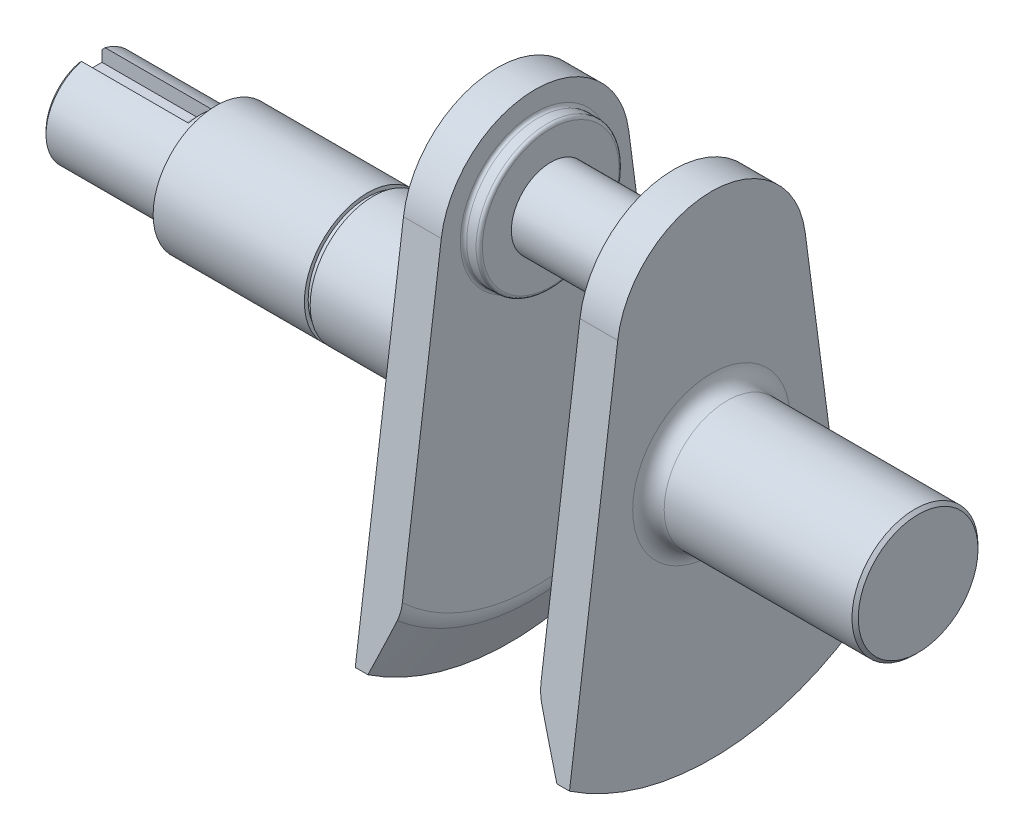
from build123d import *

# Parameters (mm, degrees)
BASE_SKETCH_R          = 12.7
BASE_DEPTH             = 166.878
FRONT_SKETCH_OUTSIDE_W = 61.54
FRONT_SKETCH_OUTSIDE_H = 61.54
FRONT_SKETCH_OUTSIDE_R = 9.525
FRONT_CUT_DEPTH        = 25.4
KEYHOLE_SKETCH_W       = 4.7752
KEYHOLE_SKETCH_H       = 6.35
KEYHOLE_DEPTH          = 22.225
KEYHOLE_FILLET_R       = 3.175
GROOVE_SKETCH_W        = 1.1684
GROOVE_SKETCH_H        = 1.524
EXTERIOR_START         = -82.042
EXTERIOR_SKETCH_R      = 12.7
EXTERIOR_CUT_DEPTH     = 43.18
SHAFT_SKETCH_R         = 19.05
SHAFT_SKETCH_R_2       = 14.4145
SHAFT_DEPTH            = 7.62
LARGE_CIRCLE_SKETCH_R  = 14.4145
LARGE_CIRCLE_DEPTH     = 3.175
BRIDGE_SKETCH_R        = 7.9375
BRIDGE_DEPTH           = 21.59
SHAFT_CHAMFER_SIZE     = 5.08
SHAFT_CHAMFER_SIZE2    = 10.894095156
REAR_CHAMFER_SIZE      = 5.08
REAR_CHAMFER_SIZE2     = 10.894095156
BACK_BASE_SKETCH_R     = 12.7
BACK_BASE_DEPTH        = 41.656
CIRCLE_FILLET_R        = 0.635
BASE_FILLET_R          = 3.175
SHAFT_FILLET_R         = 6.35
BASE_CHAMFER_SIZE      = 0.635


with BuildPart() as part:
    # Base Sketch → Base (new body)
    with BuildSketch(Plane(origin=(0, 0, 0), x_dir=(0, 0, -1), z_dir=(1, 0, 0))):
        Circle(BASE_SKETCH_R)
    extrude(amount=BASE_DEPTH)

    # Front Sketch outside → Front Cut (cut)
    with BuildSketch(Plane.ZY):
        Rectangle(FRONT_SKETCH_OUTSIDE_W, FRONT_SKETCH_OUTSIDE_H)
        Circle(FRONT_SKETCH_OUTSIDE_R, mode=Mode.SUBTRACT)
    extrude(amount=-FRONT_CUT_DEPTH, mode=Mode.SUBTRACT)

    # Keyhole Sketch → Keyhole (cut)
    with BuildSketch(Plane.ZY):
        with Locations((0, 9.525)):
            Rectangle(KEYHOLE_SKETCH_W, KEYHOLE_SKETCH_H)
    extrude(amount=-KEYHOLE_DEPTH, mode=Mode.SUBTRACT)

    # Keyhole Fillet
    keyhole_fillet_edges = [part.edges().sort_by_distance(p)[0] for p in [
        (22.225, 6.35, 0),
    ]]
    fillet(keyhole_fillet_edges, radius=KEYHOLE_FILLET_R - 0.0001)  # a hair under: the kernel refuses the full size

    # Groove Sketch → Front Groove (revolve, cut)
    with BuildSketch(Plane.XY, mode=Mode.PRIVATE) as front_groove_sk:
        with Locations((56.4642, 12.7)):
            Rectangle(GROOVE_SKETCH_W, GROOVE_SKETCH_H)
    revolve(front_groove_sk.sketch.rotate(Axis((0, 0, 0), (1, 0, 0)), 90), axis=Axis((0, 0, 0), (1, 0, 0)), mode=Mode.SUBTRACT)

    # Exterior Sketch → Exterior Cut (cut)
    with BuildSketch(Plane.ZY.offset(EXTERIOR_START)):
        Circle(EXTERIOR_SKETCH_R)
    extrude(amount=-EXTERIOR_CUT_DEPTH, mode=Mode.SUBTRACT)


with BuildPart() as body_2:
    # of the pieces the cut leaves, the one that is kept (exterior_cut_keep)
    add(part.part.solids().sort_by_distance((22.210412317, 9.220899696, 2.3876))[0])

    # Shaft Sketch → Shaft (add)
    # profile 1 of 3: a face of its own
    with BuildSketch(Plane(origin=(82.042, 0, 0), x_dir=(0, 0, -1), z_dir=(1, 0, 0))):
        with BuildLine():
            ThreePointArc((19.05, 28.575), (-1.245929612, 9.565787512), (-18.887024609, 31.061523962))
            Line((-18.887024609, 31.061523962), (-28.605503762, -42.757654032))
            ThreePointArc((-28.605503762, -42.757654032), (0, -51.444065), (28.605503762, -42.757654032))
            Line((28.605503762, -42.757654032), (18.887024609, 31.061523962))
            ThreePointArc((18.887024609, 31.061523962), (19.009212488, 29.820929612), (19.05, 28.575))
        make_face()
    # profile 2 of 3: a face of its own
    with BuildSketch(Plane(origin=(82.042, 0, 0), x_dir=(0, 0, -1), z_dir=(1, 0, 0))):
        with Locations((0, 28.575)):
            Circle(SHAFT_SKETCH_R)
        with Locations((0, 28.575)):
            Circle(SHAFT_SKETCH_R_2, mode=Mode.SUBTRACT)
    # profile 3 of 3: a face of its own
    with BuildSketch(Plane(origin=(82.042, 0, 0), x_dir=(0, 0, -1), z_dir=(1, 0, 0))):
        with Locations((0, 28.575)):
            Circle(SHAFT_SKETCH_R_2)
    shaft = extrude(amount=SHAFT_DEPTH)

    # Large Circle Sketch → Large Circle (add)
    with BuildSketch(Plane(origin=(89.662, 0, 0), x_dir=(0, 0, -1), z_dir=(1, 0, 0))):
        with Locations((0, 28.575)):
            Circle(LARGE_CIRCLE_SKETCH_R)
    large_circle = extrude(amount=LARGE_CIRCLE_DEPTH)

    # Bridge Sketch → Bridge (add)
    with BuildSketch(Plane(origin=(92.837, 0, 0), x_dir=(0, 0, -1), z_dir=(1, 0, 0))):
        with Locations((0, 28.575)):
            Circle(BRIDGE_SKETCH_R)
    extrude(amount=BRIDGE_DEPTH)

    # Shaft Chamfer
    shaft_chamfer_edges = [body_2.edges().sort_by_distance(p)[0] for p in [
        (89.662, -51.444065, 0),
    ]]
    shaft_chamfer_side = [body_2.faces().sort_by_distance(p)[0] for p in [
        (85.852, -51.444065, 0),
    ]]
    chamfer(shaft_chamfer_edges, length=SHAFT_CHAMFER_SIZE, length2=SHAFT_CHAMFER_SIZE2, reference=shaft_chamfer_side[0])

    # Large Circle Mirror: Large Circle across plane
    add(large_circle.mirror(Plane(origin=(103.632, 0, 0), x_dir=(0, 0, 1), z_dir=(1, 0, 0))))

    # Shaft Mirror: Shaft across plane
    add(shaft.mirror(Plane(origin=(103.632, 0, 0), x_dir=(0, 0, 1), z_dir=(1, 0, 0))))

    # Rear Chamfer
    rear_chamfer_edges = [body_2.edges().sort_by_distance(p)[0] for p in [
        (117.602, -51.444065, 0),
    ]]
    rear_chamfer_side = [body_2.faces().sort_by_distance(p)[0] for p in [
        (121.412, -51.444065, 0),
    ]]
    chamfer(rear_chamfer_edges, length=REAR_CHAMFER_SIZE, length2=REAR_CHAMFER_SIZE2, reference=rear_chamfer_side[0])

    # Back Base Sketch → Back Base (add)
    with BuildSketch(Plane(origin=(125.222, 0, 0), x_dir=(0, 0, -1), z_dir=(1, 0, 0))):
        with Locations(Location((0, 0, 0), (0, 0, 180))):
            Circle(BACK_BASE_SKETCH_R)
    extrude(amount=BACK_BASE_DEPTH)

    # Circle Fillet
    circle_fillet_edges = [body_2.edges().sort_by_distance(p)[0] for p in [
        (89.662, 28.575, 14.4145),
        (92.837, 28.575, 14.4145),
        (114.427, 28.575, 14.4145),
        (117.602, 28.575, 14.4145),
    ]]
    fillet(circle_fillet_edges, radius=CIRCLE_FILLET_R)

    # Base Fillet
    base_fillet_edges = [body_2.edges().sort_by_distance(p)[0] for p in [
        (125.222, 0, -12.7),
        (82.042, 0, 12.7),
    ]]
    fillet(base_fillet_edges, radius=BASE_FILLET_R)

    # Shaft Fillet
    shaft_fillet_edges = [body_2.edges().sort_by_distance(p)[0] for p in [
        (117.602, -40.549969844, 0),
        (89.662, -40.549969844, 0),
    ]]
    fillet(shaft_fillet_edges, radius=SHAFT_FILLET_R)

    # Base Chamfer
    base_chamfer_edges = [body_2.edges().sort_by_distance(p)[0] for p in [
        (166.878, 0, -12.7),
        (0, -7.532181457, -5.830254497),
    ]]
    chamfer(base_chamfer_edges, length=BASE_CHAMFER_SIZE)


solid = body_2.part
